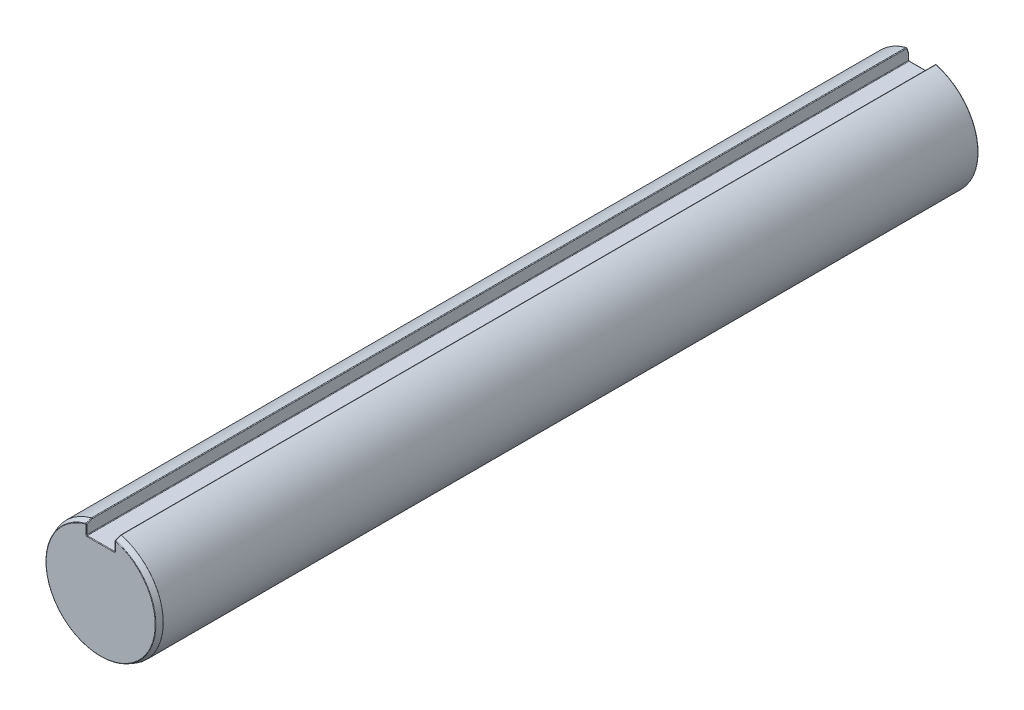
from build123d import *
from OCP.BRepFilletAPI import BRepFilletAPI_MakeChamfer

# Parameters (mm, degrees)
BOSS_EXTRUDE1_DEPTH      = 27.750000126
BOSS_EXTRUDE1_DEPTH_BACK = 41.075600094
CHAMFER1_SIZE            = 0.47625
CHAMFER1_SIZE2           = 0.173340824
FILLET1_R                = 0.047625


with BuildPart() as part:
    # Sketch3 → Boss-Extrude1 (new, two sides: drawn at the far end of the back side and taken through both)
    with BuildSketch(Plane.XY.offset(-BOSS_EXTRUDE1_DEPTH_BACK)):
        with BuildLine():
            Line((-1.1938, 3.571875), (-1.1938, 4.610449849))
            ThreePointArc((-1.1938, 4.610449849), (-2.915127249, -3.766090728), (4.7625, 0))
            ThreePointArc((4.7625, 0), (3.766090728, 2.915127249), (1.1938, 4.610449849))
            Line((1.1938, 4.610449849), (1.1938, 3.571875))
            Line((1.1938, 3.571875), (-1.1938, 3.571875))
        make_face()
    extrude(amount=BOSS_EXTRUDE1_DEPTH + BOSS_EXTRUDE1_DEPTH_BACK)

    # Chamfer1: one chamfer whose edges measure the first distance from different faces: ONE call of the kernel's chamfer builder (chamfer() names one face for all edges)
    chamfer1_edges_1 = [part.edges().sort_by_distance(p)[0] for p in [
        (-2.915127249, -3.766090728, -41.075600094),
    ]]
    chamfer1_side_1 = [part.faces().sort_by_distance(p)[0] for p in [
        (0, -0.164578508, -41.075600094),
    ]]
    chamfer1_edges_2 = [part.edges().sort_by_distance(p)[0] for p in [
        (-2.915127249, -3.766090728, 27.750000126),
    ]]
    chamfer1_side_2 = [part.faces().sort_by_distance(p)[0] for p in [
        (-2.915127249, -3.766090728, 13.875000063),
    ]]
    chamfer1 = BRepFilletAPI_MakeChamfer(part.part.solid().wrapped)
    for e in chamfer1_edges_1:
        chamfer1.Add(CHAMFER1_SIZE, CHAMFER1_SIZE2, e.wrapped, chamfer1_side_1[0].wrapped)  # the first distance lies on this face
    for e in chamfer1_edges_2:
        chamfer1.Add(CHAMFER1_SIZE, CHAMFER1_SIZE2, e.wrapped, chamfer1_side_2[0].wrapped)  # the first distance lies on this face
    add(Compound.cast(chamfer1.Shape()), mode=Mode.REPLACE)

    # Fillet1
    fillet1_edges = [part.edges().sort_by_distance(p)[0] for p in [
        (-2.791222288, -3.642727012, 27.750000126),
        (-1.1938, 4.36360182, -40.989082129),
        (-1.1938, 4.520858199, 27.511894235),
        (-2.574394474, -3.42701505, -41.075600094),
        (1.1938, 4.36360182, -40.989082129),
        (1.1938, 4.520858199, 27.511894235),
        (-2.915127249, -3.766090728, -40.90225927),
        (-2.915127249, -3.766090728, 27.273750126),
        (-1.1938, 4.610449849, -20.451129635),
        (1.1938, 4.610449849, -20.451129635),
        (1.1938, 3.571875, -20.537800047),
        (-1.1938, 3.571875, -20.537800047),
        (0, 3.571875, 27.750000126),
        (1.1938, 4.001520014, 27.750000126),
        (-1.1938, 4.001520014, 27.750000126),
        (0, 3.571875, -41.075600094),
        (1.1938, 3.844260885, -41.075600094),
        (-1.1938, 3.844260885, -41.075600094),
    ]]
    fillet(fillet1_edges, radius=FILLET1_R)


solid = part.part
